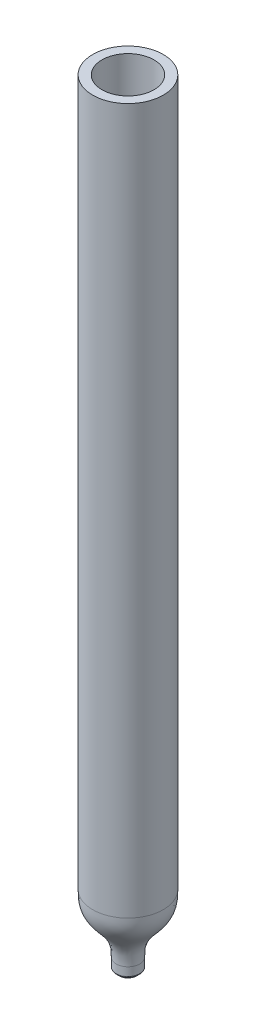
from build123d import *

# Parameters (mm, degrees)
CHAMFER1_SIZE = 0.25
FILLET1_R     = 0.1


with BuildPart() as part:
    # Sketch1 → Revolve1 (revolve)
    with BuildSketch(Plane.XY):
        with BuildLine():
            Line((2.21, 61), (3, 61))
            Line((3, 61), (3, 1))
            add(Edge.make_bspline(
                [(1, -4), (1, -2.852326224), (1, -1.704652447), (3, -1.295347553), (3, -0.147673776), (3, 1)],
                knots=[0, 0, 0, 0, 0, 0, 1, 1, 1, 1, 1, 1], degree=5))
            Line((1, -4), (1, -5))
            Line((1, -5), (0.25, -5))
            Line((0.25, -5), (0.25, -4))
            add(Edge.make_bspline(
                [(0.25, -4), (0.25, -2.870146948), (0.25, -1.740293897), (2.21, -2.259706103), (2.21, -1.129853052), (2.21, 0)],
                knots=[0, 0, 0, 0, 0, 0, 1, 1, 1, 1, 1, 1], degree=5))
            Line((2.21, 0), (2.21, 61))
        make_face()
    revolve(axis=Axis((0, 0, 0), (0, -1, 0)))

    # Chamfer1
    chamfer1_edges = [part.edges().sort_by_distance(p)[0] for p in [
        (-1, -5, 0),
    ]]
    chamfer(chamfer1_edges, length=CHAMFER1_SIZE)

    # Fillet1
    fillet1_edges = [part.edges().sort_by_distance(p)[0] for p in [
        (-1, -4.75, 0),
    ]]
    fillet(fillet1_edges, radius=FILLET1_R)


solid = part.part
